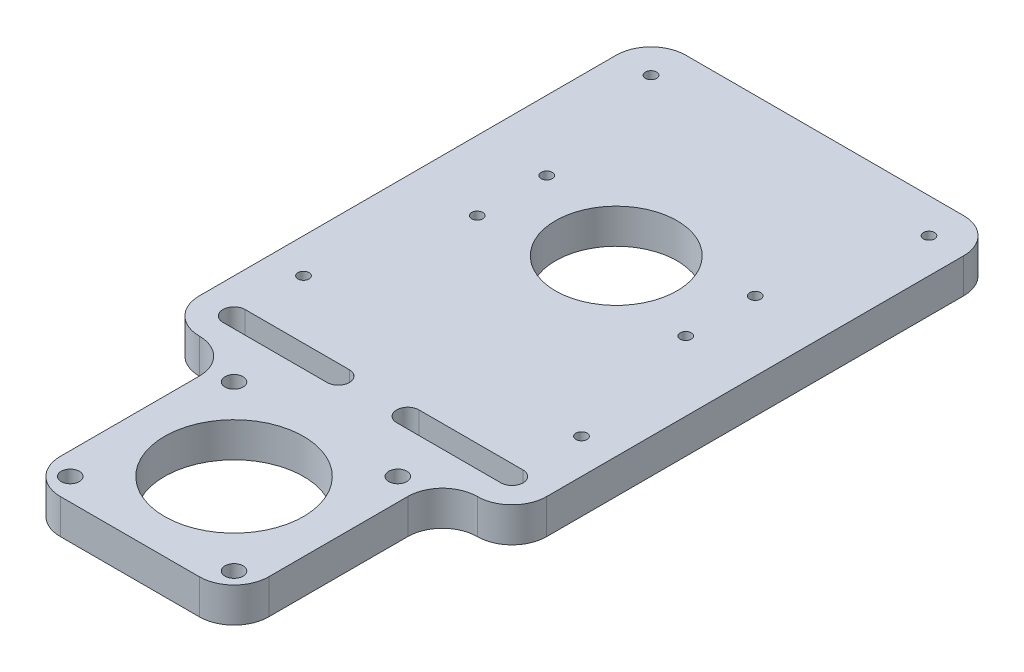
from build123d import *

# Parameters (mm, degrees)
BOSS_EXTRUDE1_DEPTH     = 10
CUT_EXTRUDE1_DEPTH      = 149.996644258
CUT_EXTRUDE1_DEPTH_BACK = 149.996644258
SKETCH2_R               = 17.5
SKETCH2_R_2             = 1.6
CUT_EXTRUDE2_DEPTH      = 149.996644258
CUT_EXTRUDE2_DEPTH_BACK = 149.996644258
SKETCH3_R               = 20
SKETCH3_R_2             = 2.6
CUT_EXTRUDE3_DEPTH      = 149.996644258
CUT_EXTRUDE3_DEPTH_BACK = 149.996644258
SKETCH4_R               = 1.6
FILLET1_R               = 10


with BuildPart() as part:
    # Sketch1 → Boss-Extrude1 (new body)
    with BuildSketch(Plane(origin=(0, 0, 0), x_dir=(1, 0, 0), z_dir=(0, 1, 0))):
        Polygon((-50, 60), (50, 60), (50, -80), (30, -80), (30, -140), (-30, -140), (-30, -80), (-50, -80), align=None)
    extrude(amount=BOSS_EXTRUDE1_DEPTH)

    # Sketch2 → Cut-Extrude1 (cut, two sides: drawn at the far end of the back side and taken through both)
    with BuildSketch(Plane(origin=(0, 10, 0), x_dir=(1, 0, 0), z_dir=(0, 1, 0)).offset(-CUT_EXTRUDE1_DEPTH_BACK)):
        with Locations(Location((0, 0, 0), (0, 0, 270))):
            Circle(SKETCH2_R)
        with Locations(Location((-40, -50, 0), (0, 0, 270))):
            Circle(SKETCH2_R_2)
        with Locations(Location((40, -50, 0), (0, 0, 270))):
            Circle(SKETCH2_R_2)
        with Locations(Location((40, 50, 0), (0, 0, 270))):
            Circle(SKETCH2_R_2)
        with Locations(Location((-40, 50, 0), (0, 0, 270))):
            Circle(SKETCH2_R_2)
        with Locations((-40, -130)):
            Circle(SKETCH2_R_2)
        with Locations((40, -130)):
            Circle(SKETCH2_R_2)
        with Locations((-40, -100)):
            Circle(SKETCH2_R_2)
        with Locations((40, -100)):
            Circle(SKETCH2_R_2)
    extrude(amount=CUT_EXTRUDE1_DEPTH + CUT_EXTRUDE1_DEPTH_BACK, mode=Mode.SUBTRACT)

    # Sketch3 → Cut-Extrude2 (cut, two sides: drawn at the far end of the back side and taken through both)
    with BuildSketch(Plane(origin=(0, 10, 0), x_dir=(1, 0, 0), z_dir=(0, 1, 0)).offset(-CUT_EXTRUDE2_DEPTH_BACK)):
        with Locations(Location((0, -110, 0), (0, 0, 270))):
            Circle(SKETCH3_R)
        with Locations(Location((-23.57, -86.43, 0), (0, 0, 270))):
            Circle(SKETCH3_R_2)
        with Locations(Location((23.57, -86.43, 0), (0, 0, 270))):
            Circle(SKETCH3_R_2)
        with Locations(Location((23.57, -133.57, 0), (0, 0, 270))):
            Circle(SKETCH3_R_2)
        with Locations(Location((-23.57, -133.57, 0), (0, 0, 270))):
            Circle(SKETCH3_R_2)
        with BuildLine():
            Line((-40, -66.8), (-10, -66.8))
            ThreePointArc((-10, -66.8), (-6.8, -70), (-10, -73.2))
            Line((-10, -73.2), (-40, -73.2))
            ThreePointArc((-40, -73.2), (-43.2, -70), (-40, -66.8))
        make_face()
        with BuildLine():
            Line((40, -66.8), (10, -66.8))
            ThreePointArc((10, -66.8), (6.8, -70), (10, -73.2))
            Line((10, -73.2), (40, -73.2))
            ThreePointArc((40, -73.2), (43.2, -70), (40, -66.8))
        make_face()
    extrude(amount=CUT_EXTRUDE2_DEPTH + CUT_EXTRUDE2_DEPTH_BACK, mode=Mode.SUBTRACT)

    # Sketch4 → Cut-Extrude3 (cut, two sides: drawn at the far end of the back side and taken through both)
    with BuildSketch(Plane(origin=(0, 10, 0), x_dir=(1, 0, 0), z_dir=(0, 1, 0)).offset(-CUT_EXTRUDE3_DEPTH_BACK)):
        with Locations(Location((-30, 10, 0), (0, 0, 270))):
            Circle(SKETCH4_R)
        with Locations(Location((-30, -10, 0), (0, 0, 270))):
            Circle(SKETCH4_R)
        with Locations(Location((30, 10, 0), (0, 0, 270))):
            Circle(SKETCH4_R)
        with Locations(Location((30, -10, 0), (0, 0, 270))):
            Circle(SKETCH4_R)
    extrude(amount=CUT_EXTRUDE3_DEPTH + CUT_EXTRUDE3_DEPTH_BACK, mode=Mode.SUBTRACT)

    # Fillet1
    fillet1_edges = [part.edges().sort_by_distance(p)[0] for p in [
        (50, 5, -60),
        (-50, 5, -60),
        (-30, 5, 80),
        (-30, 5, 140),
        (30, 5, 140),
        (30, 5, 80),
        (50, 5, 80),
        (-50, 5, 80),
    ]]
    fillet(fillet1_edges, radius=FILLET1_R - 0.0001)  # a hair under: the kernel refuses the full size


solid = part.part
